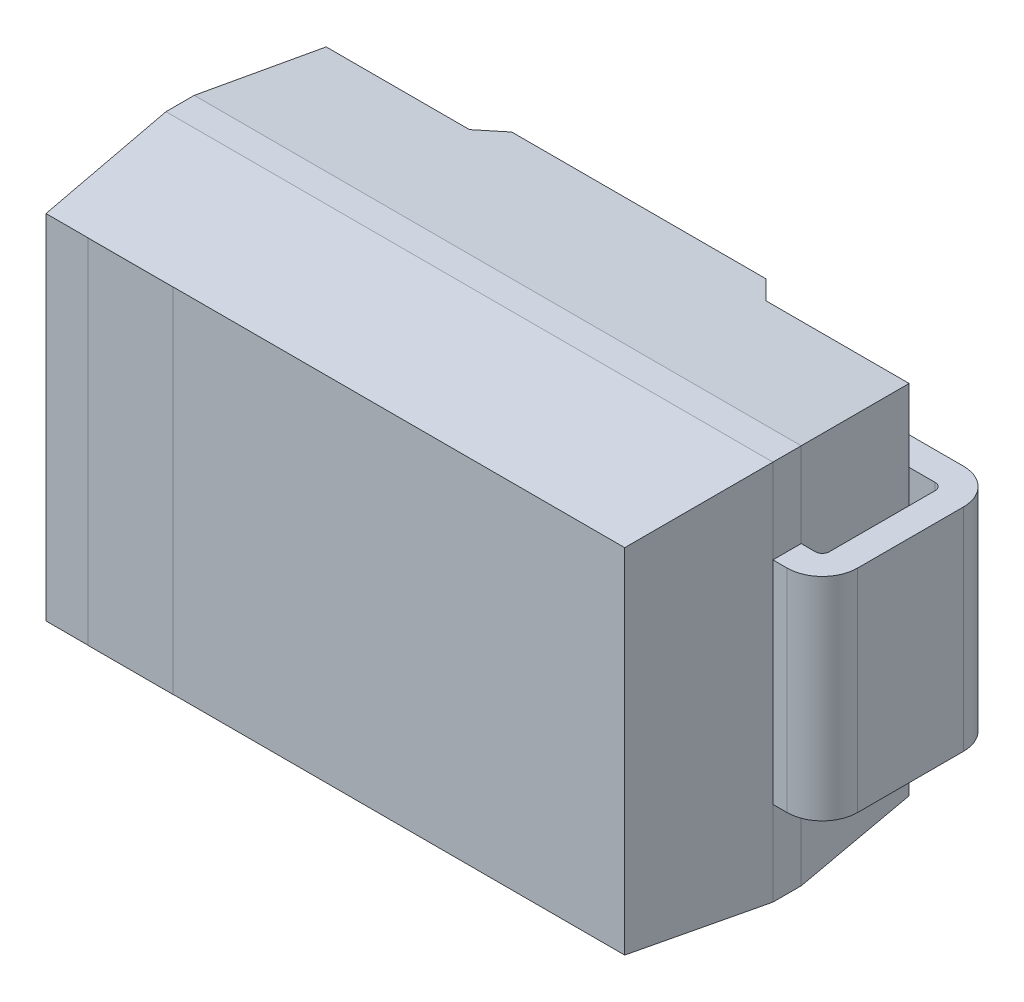
from build123d import *
from OCP.BRepFilletAPI import BRepFilletAPI_MakeChamfer

# Parameters (mm, degrees)
SZKIC1_W                    = 4.3
SZKIC1_H                    = 2.7
DODANIE_WYCI_GNI_CIE1_DEPTH = 2.15
SFAZOWANIE1_SIZE            = 0.95
SFAZOWANIE1_SIZE2           = 0.1
SFAZOWANIE2_SIZE            = 0.1
SFAZOWANIE2_SIZE2           = 1
SZKIC2_W                    = 0.6
SZKIC2_H                    = 2.5
DODANIE_WYCI_GNI_CIE2_DEPTH = 0.001
SZKIC3_W                    = 0.15
SZKIC3_H                    = 2.7
WYTNIJ_WYCI_GNI_CIE1_DEPTH  = 1.1
SFAZOWANIE3_SIZE            = 0.15
SZKIC4_W                    = 0.2
SZKIC4_H                    = 1.5
SFAZOWANIE3_OF_LUSTRO1_SIZE = 0.15


with BuildPart() as part:
    # Szkic1 → Dodanie-wyciągnięcie1 (new body)
    with BuildSketch(Plane.XY):
        Rectangle(SZKIC1_W, SZKIC1_H)
    extrude(amount=DODANIE_WYCI_GNI_CIE1_DEPTH)

    # Sfazowanie1: one chamfer whose edges measure the first distance from different faces: ONE call of the kernel's chamfer builder (chamfer() names one face for all edges)
    sfazowanie1_edges_1 = [part.edges().sort_by_distance(p)[0] for p in [
        (2.15, 0, 2.15),
    ]]
    sfazowanie1_side_1 = [part.faces().sort_by_distance(p)[0] for p in [
        (2.15, 0, 1.075),
    ]]
    sfazowanie1_edges_2 = [part.edges().sort_by_distance(p)[0] for p in [
        (0, 1.35, 2.15),
    ]]
    sfazowanie1_side_2 = [part.faces().sort_by_distance(p)[0] for p in [
        (0, 1.35, 1.075),
    ]]
    sfazowanie1_edges_3 = [part.edges().sort_by_distance(p)[0] for p in [
        (-2.15, 0, 2.15),
    ]]
    sfazowanie1_side_3 = [part.faces().sort_by_distance(p)[0] for p in [
        (-2.15, 0, 1.075),
    ]]
    sfazowanie1_edges_4 = [part.edges().sort_by_distance(p)[0] for p in [
        (0, -1.35, 2.15),
    ]]
    sfazowanie1_side_4 = [part.faces().sort_by_distance(p)[0] for p in [
        (0, -1.35, 1.075),
    ]]
    sfazowanie1 = BRepFilletAPI_MakeChamfer(part.part.solid().wrapped)
    for e in sfazowanie1_edges_1:
        sfazowanie1.Add(SFAZOWANIE1_SIZE, SFAZOWANIE1_SIZE2, e.wrapped, sfazowanie1_side_1[0].wrapped)  # the first distance lies on this face
    for e in sfazowanie1_edges_2:
        sfazowanie1.Add(SFAZOWANIE1_SIZE, SFAZOWANIE1_SIZE2, e.wrapped, sfazowanie1_side_2[0].wrapped)  # the first distance lies on this face
    for e in sfazowanie1_edges_3:
        sfazowanie1.Add(SFAZOWANIE1_SIZE, SFAZOWANIE1_SIZE2, e.wrapped, sfazowanie1_side_3[0].wrapped)  # the first distance lies on this face
    for e in sfazowanie1_edges_4:
        sfazowanie1.Add(SFAZOWANIE1_SIZE, SFAZOWANIE1_SIZE2, e.wrapped, sfazowanie1_side_4[0].wrapped)  # the first distance lies on this face
    add(Compound.cast(sfazowanie1.Shape()), mode=Mode.REPLACE)

    # Sfazowanie2
    sfazowanie2_edges = [part.edges().sort_by_distance(p)[0] for p in [
        (0, 1.35, 0),
        (2.15, 0, 0),
        (0, -1.35, 0),
        (-2.15, 0, 0),
    ]]
    sfazowanie2_side = [part.faces().sort_by_distance(p)[0] for p in [
        (0, 0, 0),
    ]]
    chamfer(sfazowanie2_edges, length=SFAZOWANIE2_SIZE, length2=SFAZOWANIE2_SIZE2, reference=sfazowanie2_side[0])

    # Szkic2 → Dodanie-wyciągnięcie2 (add)
    with BuildSketch(Plane.XY.offset(2.15)):
        with Locations((-1.45, 0)):
            Rectangle(SZKIC2_W, SZKIC2_H)
    extrude(amount=DODANIE_WYCI_GNI_CIE2_DEPTH)

    # Szkic3 → Wytnij-wyciągnięcie1 (cut)
    with BuildSketch(Plane.ZY.offset(2.15)):
        with Locations((0.075, 0)):
            Rectangle(SZKIC3_W, SZKIC3_H)
    wytnij_wyci_gni_cie1 = extrude(amount=-WYTNIJ_WYCI_GNI_CIE1_DEPTH, mode=Mode.SUBTRACT)

    # Sfazowanie3
    sfazowanie3_edges = [part.edges().sort_by_distance(p)[0] for p in [
        (-1.05, 0, 0),
    ]]
    chamfer(sfazowanie3_edges, length=SFAZOWANIE3_SIZE - 0.0001)  # a hair under: the kernel refuses the full size

    # Wyciągnięcie po ścieżce2: sweep along a path in Szkic6
    with BuildLine(Plane(origin=(0, 0, 0), x_dir=(1, 0, 0), z_dir=(0, 1, 0))) as wyci_gni_cie_po_cie_ce2_path:
        Line((-2.15, -1.2), (-2.25, -1.2))
        ThreePointArc((-2.25, -1.2), (-2.426776695, -1.126776695), (-2.5, -0.95))
        Line((-2.5, -0.95), (-2.5, -0.2))
        ThreePointArc((-2.5, -0.2), (-2.426776695, -0.023223305), (-2.25, 0.05))
        Line((-2.25, 0.05), (-1.2, 0.05))
    # Szkic4 → Wyciągnięcie po ścieżce2 (sweep)
    with BuildSketch(Plane.ZY.offset(2.15)):
        with Locations((1.1, 0)):
            Rectangle(SZKIC4_W, SZKIC4_H)
    wyci_gni_cie_po_cie_ce2 = sweep(path=wyci_gni_cie_po_cie_ce2_path.line)

    # Lustro1: Wytnij-wyciągnięcie1, Wyciągnięcie po ścieżce2 across plane
    add(wytnij_wyci_gni_cie1.mirror(Plane(origin=(0, 0, 0), x_dir=(0, 0, 1), z_dir=(1, 0, 0))), mode=Mode.SUBTRACT)
    add(wyci_gni_cie_po_cie_ce2.mirror(Plane(origin=(0, 0, 0), x_dir=(0, 0, 1), z_dir=(1, 0, 0))))

    # Sfazowanie3 of Lustro1
    sfazowanie3_of_lustro1_edges = [part.edges().sort_by_distance(p)[0] for p in [
        (1.05, 0, 0),
    ]]
    chamfer(sfazowanie3_of_lustro1_edges, length=SFAZOWANIE3_OF_LUSTRO1_SIZE - 0.0001)  # a hair under: the kernel refuses the full size


solid = part.part
